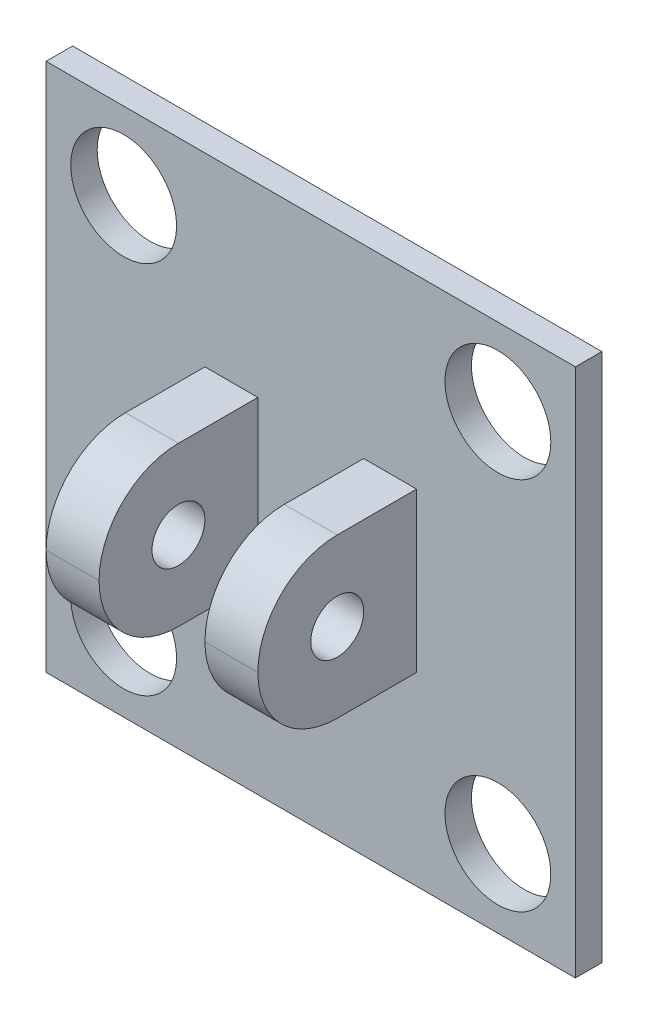
from build123d import *

# Parameters (mm, degrees)
SKETCH1_W           = 50
SKETCH1_H           = 50
SKETCH1_R           = 5
BOSS_EXTRUDE1_DEPTH = 2.5
SKETCH2_W           = 5
SKETCH2_H           = 15
BOSS_EXTRUDE2_DEPTH = 15
SKETCH3_R           = 2.5
CUT_EXTRUDE1_DEPTH  = 47.435439053
FILLET1_R           = 7.5


with BuildPart() as part:
    # Sketch1 → Boss-Extrude1 (new body)
    with BuildSketch(Plane.XY):
        Rectangle(SKETCH1_W, SKETCH1_H)
        with Locations((17.67766953, 17.67766953)):
            Circle(SKETCH1_R, mode=Mode.SUBTRACT)
        with Locations(Location((-17.67766953, 17.67766953, 0), (0, 0, 180))):
            Circle(SKETCH1_R, mode=Mode.SUBTRACT)
        with Locations(Location((17.67766953, -17.67766953, 0), (0, 0, 180))):
            Circle(SKETCH1_R, mode=Mode.SUBTRACT)
        with Locations((-17.67766953, -17.67766953)):
            Circle(SKETCH1_R, mode=Mode.SUBTRACT)
    extrude(amount=BOSS_EXTRUDE1_DEPTH)

    # Sketch2 → Boss-Extrude2 (add)
    with BuildSketch(Plane.XY.offset(2.5)):
        with Locations((-7.5, 0)):
            Rectangle(SKETCH2_W, SKETCH2_H)
        with Locations((7.5, 0)):
            Rectangle(SKETCH2_W, SKETCH2_H)
    extrude(amount=BOSS_EXTRUDE2_DEPTH)

    # Sketch3 → Cut-Extrude1 (cut, through all)
    with BuildSketch(Plane(origin=(10, 0, 0), x_dir=(0, 0, -1), z_dir=(1, 0, 0))):
        with Locations((-10, 0)):
            Circle(SKETCH3_R)
    extrude(amount=-CUT_EXTRUDE1_DEPTH, mode=Mode.SUBTRACT)

    # Fillet1
    fillet1_edges = [part.edges().sort_by_distance(p)[0] for p in [
        (-7.5, 7.5, 17.5),
        (-7.5, -7.5, 17.5),
        (7.5, -7.5, 17.5),
        (7.5, 7.5, 17.5),
    ]]
    fillet(fillet1_edges, radius=FILLET1_R - 0.0001)  # a hair under: the kernel refuses the full size


solid = part.part
